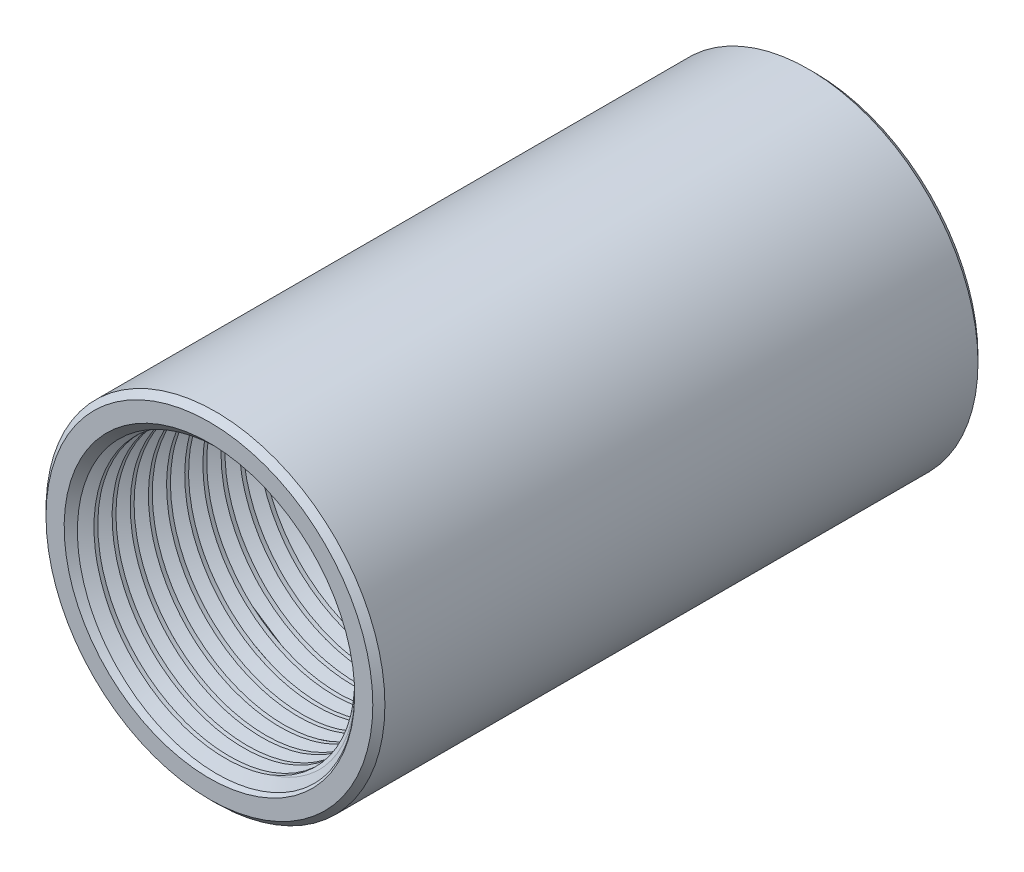
from build123d import *

# Parameters (mm, degrees)
SKETCH_1_R      = 14
EXTRUDE_1_DEPTH = 50
SHELL_1_T       = -3
CHAMFER_1_SIZE  = 0.5
CHAMFER_2_SIZE  = 1
SWEEP_1_PITCH   = 1.5


with BuildPart() as part:
    # 草图1 → 拉伸1 (new body)
    with BuildSketch(Plane.XY):
        Circle(SKETCH_1_R)
    extrude(amount=EXTRUDE_1_DEPTH)

    # 抽壳1
    shell_1_openings = [part.faces().sort_by_distance(p)[0] for p in [
        (0, 0, 50),
        (0, 0, 0),
    ]]
    offset(amount=SHELL_1_T, openings=shell_1_openings, kind=Kind.INTERSECTION)

    # 倒角1
    chamfer_1_edges = [part.edges().sort_by_distance(p)[0] for p in [
        (-14, 0, 0),
        (-14, 0, 50),
    ]]
    chamfer(chamfer_1_edges, length=CHAMFER_1_SIZE)

    # 倒角2
    chamfer_2_edges = [part.edges().sort_by_distance(p)[0] for p in [
        (-11, 0, 0),
        (-11, 0, 50),
    ]]
    chamfer(chamfer_2_edges, length=CHAMFER_2_SIZE)

    # 切除-扫描1: arcs per turn and ends read off the stored shape
    # 切除-扫描1: the profile of 草图6 screwed along a right-hand helix through 38 turns, 6 arcs to a turn; built about Z, then put on its axis
    sweep_1_z = Axis((0, 0, 0), (0, 0, 1))
    sweep_1_corners = [(10.9, 0, -0.6625), (10.9, 0, -1.9625), (12, 0, -1.3125)]
    with BuildLine(mode=Mode.PRIVATE) as sweep_1_profile:
        Line(sweep_1_corners[0], sweep_1_corners[1])
        Line(sweep_1_corners[1], sweep_1_corners[2])
        Line(sweep_1_corners[2], sweep_1_corners[0])
    sweep_1_cap = Face(sweep_1_profile.wire())
    sweep_1_turn_angles = [0, 30, 60, 90, 120, 150, 180, 210, 240, 270, 300, 330, 360]
    sweep_1_turn_weights = [1, 0.8660254037844387, 1, 0.8660254037844387, 1, 0.8660254037844387, 1, 0.8660254037844387, 1, 0.8660254037844387, 1, 0.8660254037844387, 1]
    sweep_1_turn_rails = [Edge.make_bspline([Vector(p[0], p[1], 0).rotate(sweep_1_z, sweep_1_turn_angles[k]) / sweep_1_turn_weights[k] + Vector(0, 0, p[2] + SWEEP_1_PITCH * sweep_1_turn_angles[k] / 360) for k in range(13)], [0, 0, 0, 1, 1, 2, 2, 3, 3, 4, 4, 5, 5, 6, 6, 6], 2, sweep_1_turn_weights) for p in sweep_1_corners]
    sweep_1_turn_sides = [Face.make_surface_from_curves(sweep_1_turn_rails[p[0]], sweep_1_turn_rails[p[1]]) for p in [(0, 1), (1, 2), (2, 0)]]
    sweep_1 = Plane(origin=(0, 0, 0), x_dir=(0.7071067811865414, -0.7071067811865537, 0), z_dir=(0, 0, 1)) * Solid(Shell([*[p.moved(Location((0, 0, SWEEP_1_PITCH * i))) for i in range(38) for p in sweep_1_turn_sides], sweep_1_cap, sweep_1_cap.rotate(sweep_1_z, 13680).moved(Location((0, 0, SWEEP_1_PITCH * 13680 / 360)))]))
    add(sweep_1, mode=Mode.SUBTRACT)


solid = part.part
